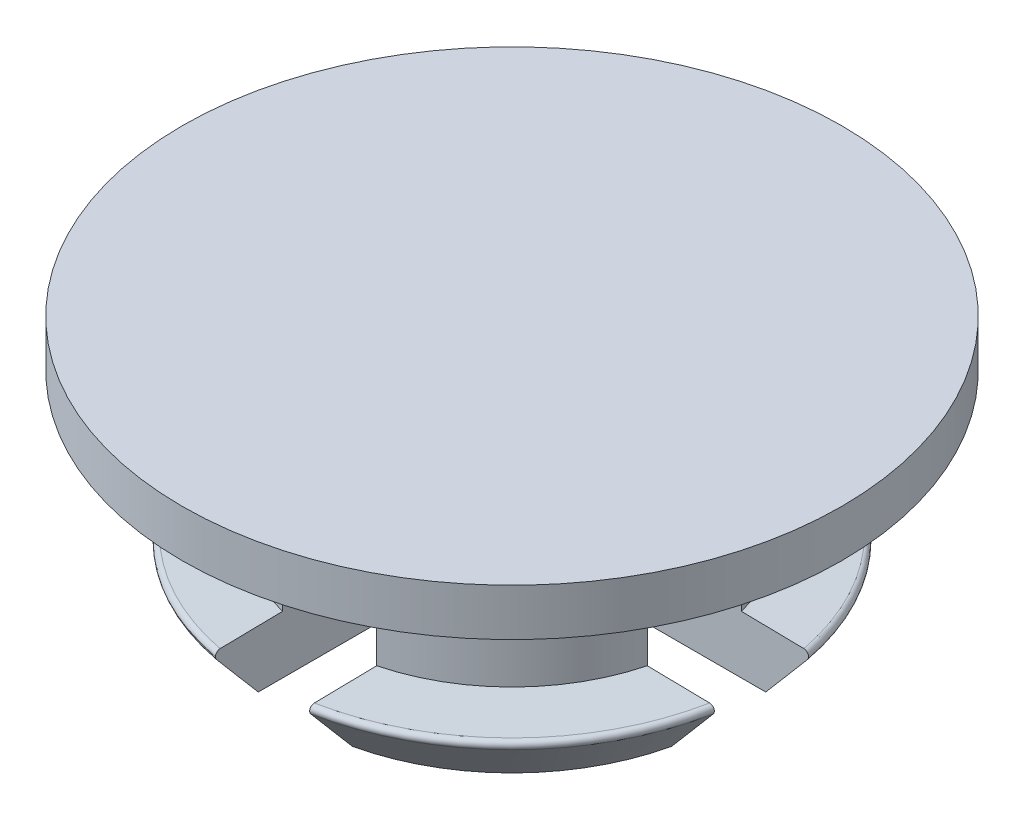
from build123d import *

# Parameters (mm, degrees)
SZKIC1_R                    = 7
DODANIE_WYCI_GNI_CIE1_DEPTH = 1
SZKIC2_R                    = 4
DODANIE_WYCI_GNI_CIE2_DEPTH = 4.22
ZAOKR_GLENIE1_R             = 0.1
WYTNIJ_WYCI_GNI_CIE1_DEPTH  = 4.22


with BuildPart() as part:
    # Szkic1 → Dodanie-wyciągnięcie1 (new body)
    with BuildSketch(Plane(origin=(0, 0, 0), x_dir=(1, 0, 0), z_dir=(0, 1, 0))):
        Circle(SZKIC1_R)
    extrude(amount=DODANIE_WYCI_GNI_CIE1_DEPTH)

    # Szkic2 → Dodanie-wyciągnięcie2 (add)
    with BuildSketch(Plane(origin=(0, 0, 0), x_dir=(-1, 0, 0), z_dir=(0, -1, 0))):
        Circle(SZKIC2_R)
    extrude(amount=DODANIE_WYCI_GNI_CIE2_DEPTH)

    # Szkic3 → Obrót1 (revolve)
    with BuildSketch(Plane(origin=(0, 0, 0), x_dir=(0, 0, -1), z_dir=(1, 0, 0))):
        Polygon((4, -4.22), (4.5, -4.22), (5.5, -3.02), (4, -2.993817403), align=None)
    revolve(axis=Axis((0, -4.22, 0), (0, 1, 0)))

    # Zaokrąglenie1
    zaokr_glenie1_edges = [part.edges().sort_by_distance(p)[0] for p in [
        (0, -3.02, 5.5),
    ]]
    fillet(zaokr_glenie1_edges, radius=ZAOKR_GLENIE1_R)

    # Szkic5 → Wytnij-wyciągnięcie1 (cut)
    with BuildSketch(Plane(origin=(0, -4.22, 0), x_dir=(-1, 0, 0), z_dir=(0, -1, 0))):
        with BuildLine():
            Line((-7.794060286, -1), (-1, -1))
            Line((-1, -1), (-1, -7.794060286))
            ThreePointArc((-1, -7.794060286), (0, -7.857949844), (1, -7.794060286))
            Line((1, -7.794060286), (1, -1))
            Line((1, -1), (7.794060286, -1))
            ThreePointArc((7.794060286, -1), (7.857949844, 0), (7.794060286, 1))
            Line((7.794060286, 1), (1, 1))
            Line((1, 1), (1, 7.794060286))
            ThreePointArc((1, 7.794060286), (0, 7.857949844), (-1, 7.794060286))
            Line((-1, 7.794060286), (-1, 1))
            Line((-1, 1), (-7.794060286, 1))
            ThreePointArc((-7.794060286, 1), (-7.857949844, 0), (-7.794060286, -1))
        make_face()
    extrude(amount=-WYTNIJ_WYCI_GNI_CIE1_DEPTH, mode=Mode.SUBTRACT)


solid = part.part
